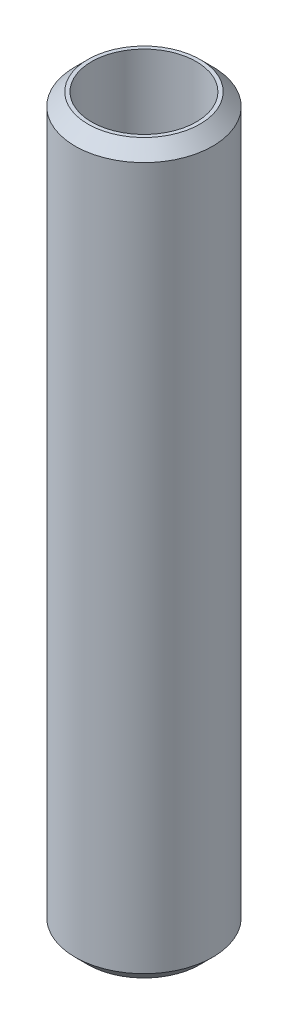
from build123d import *

# Parameters (mm, degrees)
SKETCH1_R           = 20
BOSS_EXTRUDE1_DEPTH = 211.609010678
SKETCH2_R           = 15.214353887
CUT_EXTRUDE1_DEPTH  = 214.490921119
CHAMFER1_SIZE       = 3.704559677


with BuildPart() as part:
    # Sketch1 → Boss-Extrude1 (new body)
    with BuildSketch(Plane(origin=(0, 0, 0), x_dir=(1, 0, 0), z_dir=(0, 1, 0))):
        Circle(SKETCH1_R)
    extrude(amount=BOSS_EXTRUDE1_DEPTH)

    # Sketch2 → Cut-Extrude1 (cut, through all)
    with BuildSketch(Plane(origin=(0, 0, 0), x_dir=(1, 0, 0), z_dir=(0, 1, 0))):
        Circle(SKETCH2_R)
    extrude(amount=CUT_EXTRUDE1_DEPTH, mode=Mode.SUBTRACT)

    # Chamfer1
    chamfer1_edges = [part.edges().sort_by_distance(p)[0] for p in [
        (-20, 211.609010678, 0),
        (-20, 0, 0),
    ]]
    chamfer(chamfer1_edges, length=CHAMFER1_SIZE)


solid = part.part
